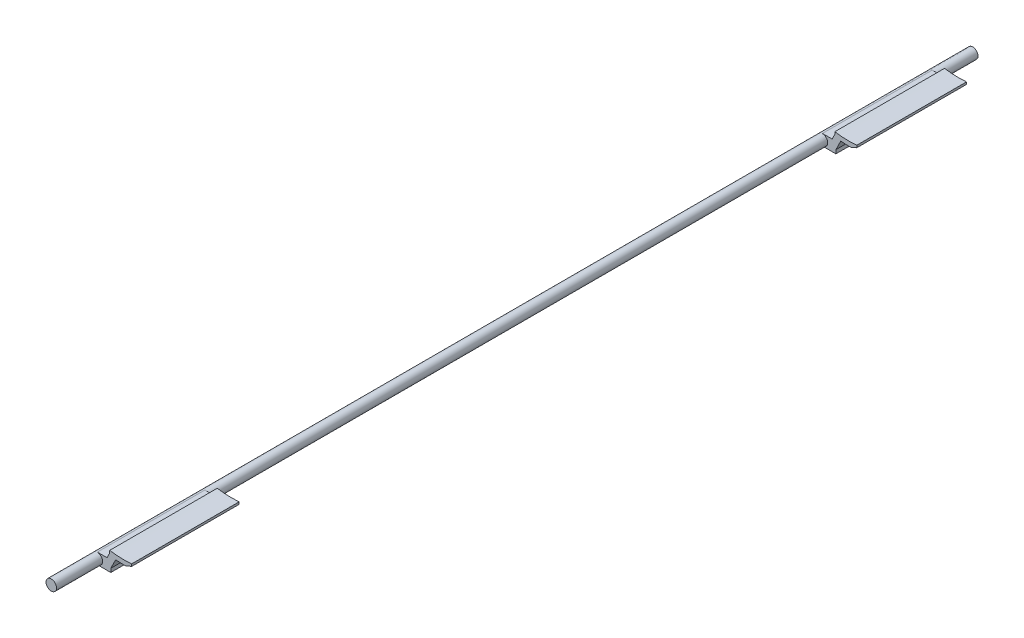
from build123d import *

# Parameters (mm, degrees)
BOSS_EXTRUDE1_DEPTH      = 49
CHAMFER1_SIZE            = 1
CHAMFER2_SIZE            = 1
SKETCH4_W                = 3.006754005
SKETCH4_H                = 49
BOSS_EXTRUDE2_DEPTH      = 5
SKETCH5_W                = 49
SKETCH5_H                = 5
BOSS_EXTRUDE3_DEPTH      = 6.139242
BOSS_EXTRUDE4_DEPTH      = 350
BOSS_EXTRUDE4_DEPTH_BACK = 70
SKETCH6_R                = 2.4
BOSS_EXTRUDE5_START      = 50
BOSS_EXTRUDE5_DEPTH      = 50
SKETCH11_R               = 0.5
BOSS_EXTRUDE9_DEPTH      = 2


with BuildPart() as part:
    # Sketch1 → Boss-Extrude1 (new body)
    with BuildSketch(Plane.XY):
        with BuildLine():
            Line((-6.350615501, -38.986147319), (-6.350615501, -41.01121411))
            ThreePointArc((-6.350615501, -41.01121411), (-1.360537007, -41.477692065), (3.649384499, -41.339230675))
            Line((3.649384499, -41.339230675), (3.649384499, -39.331056339))
            ThreePointArc((3.649384499, -39.331056339), (-1.361580989, -39.476525901), (-6.350615501, -38.986147319))
        make_face()
    extrude(amount=BOSS_EXTRUDE1_DEPTH)

    # Chamfer1
    # the kernel refuses this chamfer: 3, 1 mm, written as the material it takes off along each edge
    with BuildSketch(Plane(origin=(3.649384499, -41.339230675, -7.093753287), x_dir=(0, 1, 0), z_dir=(0, 0, 1))) as chamfer1_piece_1:
        with BuildLine():
            Line((CHAMFER1_SIZE, 0), (-0.150364113, 2.720124405))
            ThreePointArc((-0.150364113, 2.720124405), (-0.100586913, 1.415213895), (0, 0))
            Line((0, 0), (CHAMFER1_SIZE, 0))
        make_face()
    extrude(amount=63.187506575, mode=Mode.SUBTRACT)

    # Chamfer2
    # the kernel refuses this chamfer: 3, 1 mm, written as the material it takes off along each edge
    with BuildSketch(Plane(origin=(-6.350615501, -41.01121411, -7.077780992), x_dir=(0.992702552846142, -0.12058872904526673, 0), z_dir=(0, 0, 1))) as chamfer2_piece_1:
        with BuildLine():
            Line((2.717564067, 0), (-CHAMFER2_SIZE * 0.120588729045, CHAMFER2_SIZE * 0.992702552846))
            Line((-CHAMFER2_SIZE * 0.120588729045, CHAMFER2_SIZE * 0.992702552846), (0, 0))
            ThreePointArc((0, 0), (1.415420862, -0.022211756), (2.717564067, 0))
        make_face()
    extrude(amount=63.155561983, mode=Mode.SUBTRACT)

    # Sketch4 → Boss-Extrude2 (add)
    with BuildSketch(Plane(origin=(-17.090415502, -34.725548264, 0), x_dir=(0.8972243095002063, -0.44157506546665215, 0), z_dir=(-0.44157506546665215, -0.8972243095002063, 0))):
        with Locations((13.473404886, 24.5)):
            Rectangle(SKETCH4_W, SKETCH4_H)
    extrude(amount=BOSS_EXTRUDE2_DEPTH)

    # Sketch5 → Boss-Extrude3 (add)
    with BuildSketch(Plane(origin=(-12, 0, 0), x_dir=(0, 0, -1), z_dir=(1, 0, 0))):
        with Locations((-24.5, -45.003805325)):
            Rectangle(SKETCH5_W, SKETCH5_H)
    extrude(amount=BOSS_EXTRUDE3_DEPTH)

    # Sketch6 → Boss-Extrude4 (add, two sides: drawn at the far end of the back side and taken through both)
    with BuildSketch(Plane(origin=(0, 0, 0), x_dir=(-1, 0, 0), z_dir=(0, 0, -1)).offset(-BOSS_EXTRUDE4_DEPTH_BACK)):
        with Locations((12, -45.003805325)):
            Circle(SKETCH6_R)
    extrude(amount=BOSS_EXTRUDE4_DEPTH + BOSS_EXTRUDE4_DEPTH_BACK)

    # Sketch8 → Boss-Extrude5 (add)
    with BuildSketch(Plane(origin=(0, 0, -281.5), x_dir=(-1, 0, 0), z_dir=(0, 0, -1)).offset(BOSS_EXTRUDE5_START)):
        with BuildLine():
            Line((12, -47.503805325), (12, -47.403805325))
            ThreePointArc((12, -47.403805325), (9.6, -45.003805325), (12, -42.603805325))
            Line((12, -42.603805325), (12, -42.503805325))
            Line((12, -42.503805325), (7.577361274, -42.503805325))
            Line((7.577361274, -42.503805325), (6.350615501, -40.01121411))
            Line((6.350615501, -40.01121411), (6.350615501, -38.986147319))
            ThreePointArc((6.350615501, -38.986147319), (1.361580989, -39.476525901), (-3.649384499, -39.331056339))
            Line((-3.649384499, -39.331056339), (-3.649384499, -40.339230675))
            Line((-3.649384499, -40.339230675), (-0.929260095, -41.489594788))
            ThreePointArc((-0.929260095, -41.489594788), (1.363893558, -41.477581829), (3.652882714, -41.338921707))
            Line((3.652882714, -41.338921707), (5.860758041, -45.825043254))
            Line((5.860758041, -45.825043254), (5.860758041, -47.503805325))
            Line((5.860758041, -47.503805325), (12, -47.503805325))
        make_face()
    extrude(amount=-BOSS_EXTRUDE5_DEPTH)

    # Sketch11 → Boss-Extrude9 (add)
    with BuildSketch(Plane(origin=(0, 0, -140.75), x_dir=(-1, 0, 0), z_dir=(0, 0, -1))):
        with BuildLine():
            Line((14.769764267, -46.385196028), (14.147707084, -46.074951572))
            ThreePointArc((14.147707084, -46.074951572), (13.091170315, -47.141408503), (11.607713099, -47.371528068))
            Line((11.607713099, -47.371528068), (14.647174611, -47.875109386))
            ThreePointArc((14.647174611, -47.875109386), (15.517238353, -47.196697988), (14.769764267, -46.385196028))
        make_face()
        with Locations((14.769764267, -47.135196028)):
            Circle(SKETCH11_R, mode=Mode.SUBTRACT)
    extrude(amount=BOSS_EXTRUDE9_DEPTH)


solid = part.part
